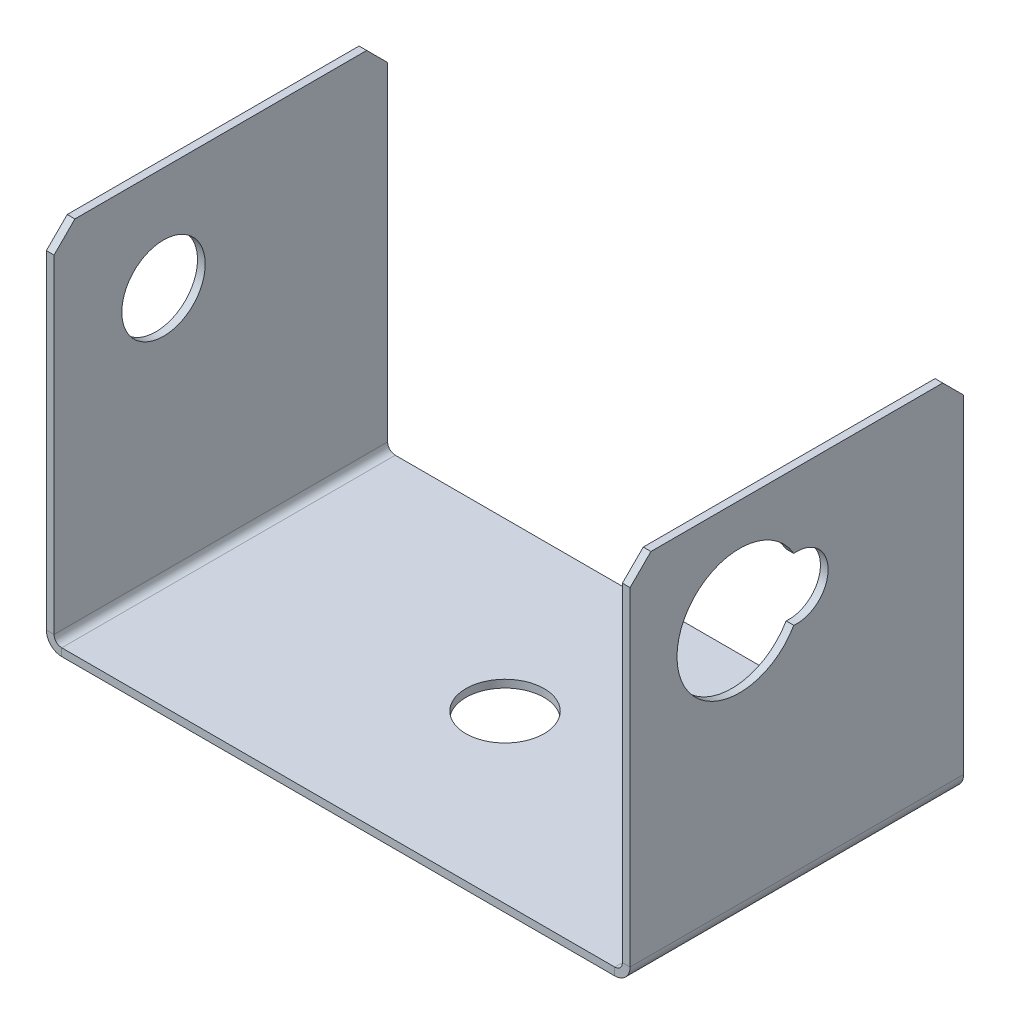
from build123d import *

# Parameters (mm, degrees)
BASE_FLANGE1_DEPTH = 32
CUT_EXTRUDE1_DEPTH = 10
SKETCH7_R          = 4
CUT_EXTRUDE2_DEPTH = 10
SKETCH8_R          = 3.75
CUT_EXTRUDE3_DEPTH = 10
CHAMFER1_SIZE      = 2


# Sheet-metal steps are written as plain solids
with BuildPart() as part:
    # Sketch1 → Base-Flange1 (new body)
    with BuildSketch(Plane.XY):
        with BuildLine():
            Line((56, 35), (56, 1.4732))
            ThreePointArc((56, 1.4732), (55.56850971, 0.43149029), (54.5268, 0))
            Line((54.5268, 0), (1.4732, 0))
            ThreePointArc((1.4732, 0), (0.43149029, 0.43149029), (0, 1.4732))
            Line((0, 1.4732), (0, 35))
            Line((0, 35), (0.7366, 35))
            Line((0.7366, 35), (0.7366, 1.4732))
            ThreePointArc((0.7366, 1.4732), (0.952345145, 0.952345145), (1.4732, 0.7366))
            Line((1.4732, 0.7366), (54.5268, 0.7366))
            ThreePointArc((54.5268, 0.7366), (55.047654855, 0.952345145), (55.2634, 1.4732))
            Line((55.2634, 1.4732), (55.2634, 35))
            Line((55.2634, 35), (56, 35))
        make_face()
    extrude(amount=BASE_FLANGE1_DEPTH)

    # Sketch6 → Cut-Extrude1 (cut)
    with BuildSketch(Plane(origin=(56, 0, 0), x_dir=(0, 0, -1), z_dir=(1, 0, 0))):
        with BuildLine():
            ThreePointArc((-16.295454545, 27.985415651), (-27.5, 25), (-16.295454545, 22.014584349))
            ThreePointArc((-16.295454545, 22.014584349), (-13, 25), (-16.295454545, 27.985415651))
        make_face()
    extrude(amount=-CUT_EXTRUDE1_DEPTH, mode=Mode.SUBTRACT)

    # Sketch7 → Cut-Extrude2 (cut)
    with BuildSketch(Plane.ZY):
        with Locations((21.5, 25)):
            Circle(SKETCH7_R)
    extrude(amount=-CUT_EXTRUDE2_DEPTH, mode=Mode.SUBTRACT)

    # Sketch8 → Cut-Extrude3 (cut)
    with BuildSketch(Plane(origin=(0, 0.7366, 0), x_dir=(1, 0, 0), z_dir=(0, 1, 0))):
        with Locations(Location((28, -16, 0), (0, 0, 270))):
            Circle(SKETCH8_R)
    extrude(amount=-CUT_EXTRUDE3_DEPTH, mode=Mode.SUBTRACT)

    # Chamfer1
    chamfer1_edges = [part.edges().sort_by_distance(p)[0] for p in [
        (0.3683, 35, 0),
        (55.6317, 35, 0),
        (0.3683, 35, 32),
        (55.6317, 35, 32),
    ]]
    chamfer(chamfer1_edges, length=CHAMFER1_SIZE)


solid = part.part
